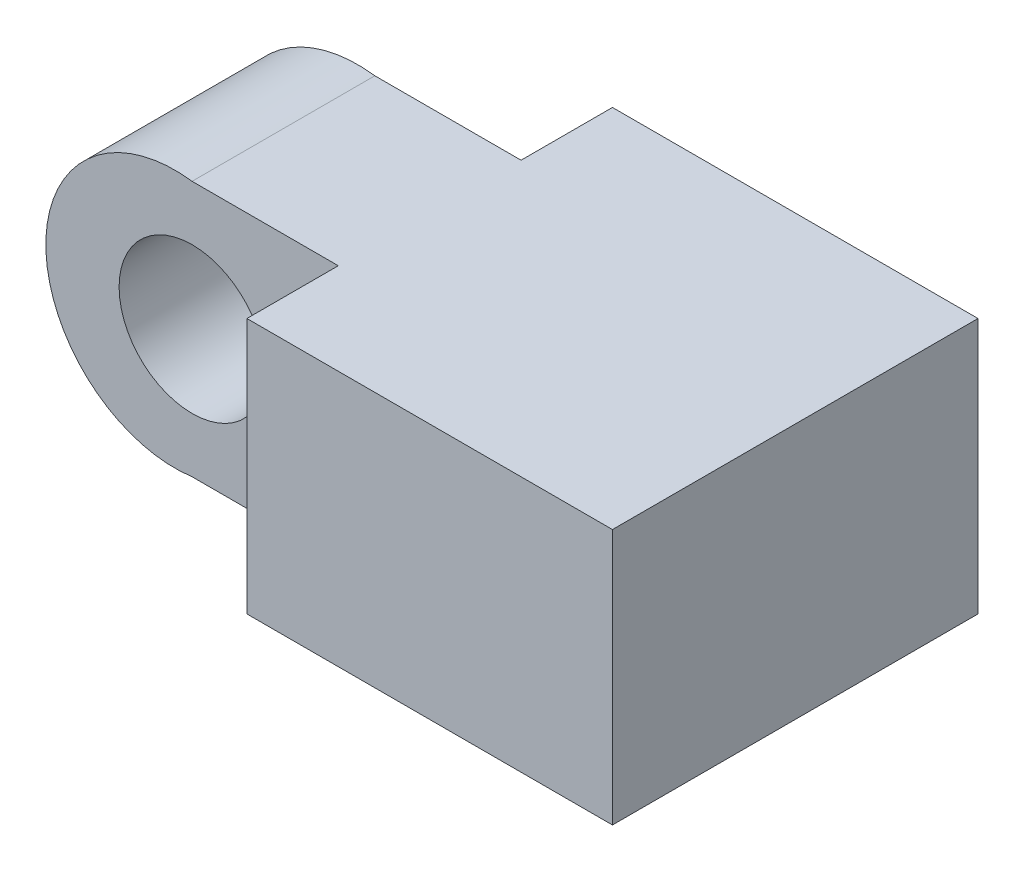
from build123d import *

# Parameters (mm, degrees)
ESQUISSE1_W                  = 10
ESQUISSE1_H                  = 10
BOSS_EXTRU_1_DEPTH           = 7
BOSS_EXTRU_2_DEPTH           = 10
ESQUISSE6_R                  = 2
ENL_V_MAT_EXTRU_1_DEPTH      = 16.793621388
ENL_V_MAT_EXTRU_5_DEPTH      = 16.793621388
ENL_V_MAT_EXTRU_5_DEPTH_BACK = 16.793621388
ESQUISSE8_W                  = 9.997133648
ESQUISSE8_H                  = 2.5
ESQUISSE8_W_2                = 9.640223126


with BuildPart() as part:
    # Esquisse1 → Boss.-Extru.1 (new body)
    with BuildSketch(Plane(origin=(0, 0, 0), x_dir=(1, 0, 0), z_dir=(0, 1, 0))):
        with Locations((5, 5)):
            Rectangle(ESQUISSE1_W, ESQUISSE1_H)
    extrude(amount=BOSS_EXTRU_1_DEPTH)

    # Esquisse2 → Boss.-Extru.2 (add)
    with BuildSketch(Plane.XY):
        with BuildLine():
            Line((0, 7), (0, 0))
            Line((0, 0), (-4, 0))
            ThreePointArc((-4, 0), (-8, 3.5), (-4, 7))
            Line((-4, 7), (0, 7))
        make_face()
    extrude(amount=-BOSS_EXTRU_2_DEPTH)

    # Esquisse6 → Enlèv. mat.-Extru.1 (cut, through all)
    with BuildSketch(Plane.XY):
        with Locations((-3.99631755, 3.5)):
            Circle(ESQUISSE6_R)
    extrude(amount=-ENL_V_MAT_EXTRU_1_DEPTH, mode=Mode.SUBTRACT)

    # Esquisse8 → Enlèv. mat.-Extru.5 (cut, two sides: drawn at the far end of the back side and taken through both)
    with BuildSketch(Plane(origin=(0, 0, 0), x_dir=(1, 0, 0), z_dir=(0, 1, 0)).offset(-ENL_V_MAT_EXTRU_5_DEPTH_BACK)):
        with Locations((-4.998566824, 1.25)):
            Rectangle(ESQUISSE8_W, ESQUISSE8_H)
        with Locations((-4.820111563, 8.75)):
            Rectangle(ESQUISSE8_W_2, ESQUISSE8_H)
    extrude(amount=ENL_V_MAT_EXTRU_5_DEPTH + ENL_V_MAT_EXTRU_5_DEPTH_BACK, mode=Mode.SUBTRACT)


solid = part.part
